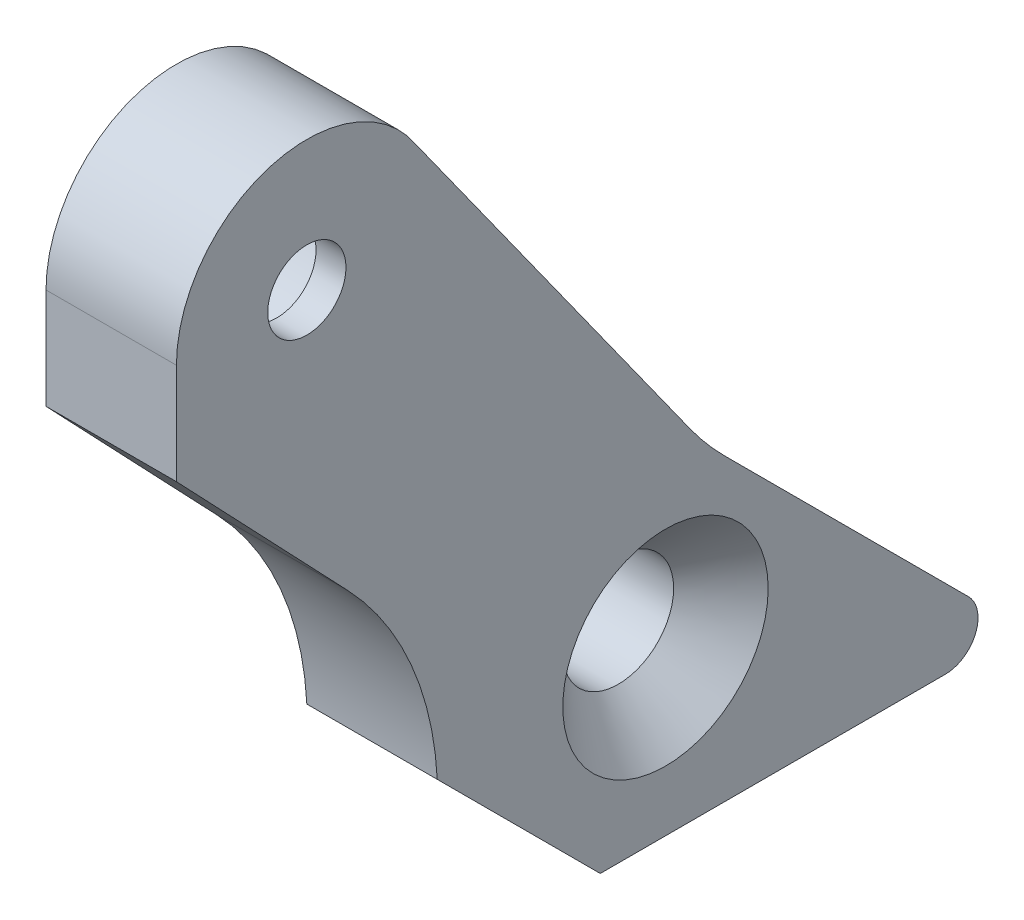
from build123d import *

# Parameters (mm, degrees)
RESSALTO_EXTRUS_O1_DEPTH                             = 4
FURO_DE_DI_METRO_6_0_6_1_D                           = 6
FURO_DE_DI_METRO_6_0_6_1_DEPTH                       = 2
FURO_DE_DI_METRO_6_0_6_1_TIP                         = 1.802581857
ESBO_O4_R                                            = 1.2
CORTE_EXTRUS_O1_DEPTH                                = 32.271167096
ESCAREADO_PARA_PARAFUSO_COM_CABE_A_ESCAR_D           = 3.4
ESCAREADO_PARA_PARAFUSO_COM_CABE_A_ESCAR_CSINK_D     = 6.3
ESCAREADO_PARA_PARAFUSO_COM_CABE_A_ESCAR_CSINK_ANGLE = 90
FILETE1_R                                            = 10
FILETE2_R                                            = 1


with BuildPart() as part:
    # Esboço1 → Ressalto-extrusão1 (new body)
    with BuildSketch(Plane(origin=(0, 0, 0), x_dir=(0, 0, -1), z_dir=(1, 0, 0))):
        with BuildLine():
            Line((0, 0), (0, 3.091839499))
            ThreePointArc((0, 3.091839499), (2.870368785, 6.92901728), (7.361966659, 5.259137398))
            Line((7.361966659, 5.259137398), (16.225984495, -7.134144996))
            Line((16.225984495, -7.134144996), (26, -16.908160501))
            Line((26, -16.908160501), (13, -16.908160501))
            Line((13, -16.908160501), (8, -11.908160501))
            Line((8, -11.908160501), (8, -8.399335203))
            Line((8, -8.399335203), (0, 0))
        make_face()
    extrude(amount=RESSALTO_EXTRUS_O1_DEPTH)

    # Furo de diâmetro Ø6.0 (6)1
    with Locations(Plane.ZY):
        with Locations((-4, 3.091839499)):
            Hole(FURO_DE_DI_METRO_6_0_6_1_D / 2, depth=FURO_DE_DI_METRO_6_0_6_1_DEPTH)
            with Locations((0, 0, -(FURO_DE_DI_METRO_6_0_6_1_DEPTH + FURO_DE_DI_METRO_6_0_6_1_TIP / 2))):  # 118° drill point
                Cone(0, FURO_DE_DI_METRO_6_0_6_1_D / 2, FURO_DE_DI_METRO_6_0_6_1_TIP, mode=Mode.SUBTRACT)

    # Esboço4 → Corte-extrusão1 (cut, through all)
    with BuildSketch(Plane(origin=(4, 0, 0), x_dir=(0, 0, -1), z_dir=(1, 0, 0))):
        with Locations((4, 3.091839499)):
            Circle(ESBO_O4_R)
    extrude(amount=-CORTE_EXTRUS_O1_DEPTH, mode=Mode.SUBTRACT)

    # Escareado para parafuso com cabeça escareada chata de M31 (through all)
    with Locations(Plane(origin=(4, 0, 0), x_dir=(0, 0, -1), z_dir=(1, 0, 0))):
        with Locations((15, -11.908160501)):
            CounterSinkHole(ESCAREADO_PARA_PARAFUSO_COM_CABE_A_ESCAR_D / 2, ESCAREADO_PARA_PARAFUSO_COM_CABE_A_ESCAR_CSINK_D / 2, counter_sink_angle=ESCAREADO_PARA_PARAFUSO_COM_CABE_A_ESCAR_CSINK_ANGLE)

    # Filete1
    # the kernel refuses this fillet: 10 mm, written as the material it adds along each edge
    with BuildSketch(Plane(origin=(0, -8.399335203, -8), x_dir=(0, 0.724110671276106, 0.6896837940274276), z_dir=(1, 0, 0))) as filete1_piece_1:
        with BuildLine():
            CenterArc((3.981744366, 10), FILETE1_R, 229.288374317, 40.711625683)
            Line((-2.540777842, 2.419979944), (-2.671228286, 2.268379543))
            ThreePointArc((-2.671228286, 2.268379543), (-1.40832568, 1.065167838), (-0.137936759, -0.144822134))
            Line((-0.137936759, -0.144822134), (0, -0.2))
            Line((0, -0.2), (3.981744366, -0.2))
            Line((3.981744366, -0.2), (3.981744366, 0))
        make_face()
    extrude(amount=4)
    with BuildSketch(Plane(origin=(0, -7.134144996, -16.225984495), x_dir=(0, -0.7071067811865512, -0.7071067811865437), z_dir=(1, 0, 0))) as filete1_piece_2:
        with BuildLine():
            CenterArc((FILETE1_R * 0.0824486959728, FILETE1_R), FILETE1_R, 260.573396821, 9.426603179)
            Line((-FILETE1_R * 0.0813353269941, FILETE1_R * 0.0135037791148), (-FILETE1_R * 0.0846110074534, -FILETE1_R * 0.00622614530291))
            Line((-FILETE1_R * 0.0846110074534, -FILETE1_R * 0.00622614530291), (-FILETE1_R * 0.00164897391946, -FILETE1_R * 0.02))
            Line((-FILETE1_R * 0.00164897391946, -FILETE1_R * 0.02), (FILETE1_R * 0.0824486959728, -FILETE1_R * 0.02))
            Line((FILETE1_R * 0.0824486959728, -FILETE1_R * 0.02), (FILETE1_R * 0.0824486959728, 0))
        make_face()
    extrude(amount=4)

    # Filete2
    filete2_edges = [part.edges().sort_by_distance(p)[0] for p in [
        (2, -16.908160501, -26),
    ]]
    fillet(filete2_edges, radius=FILETE2_R)


solid = part.part
